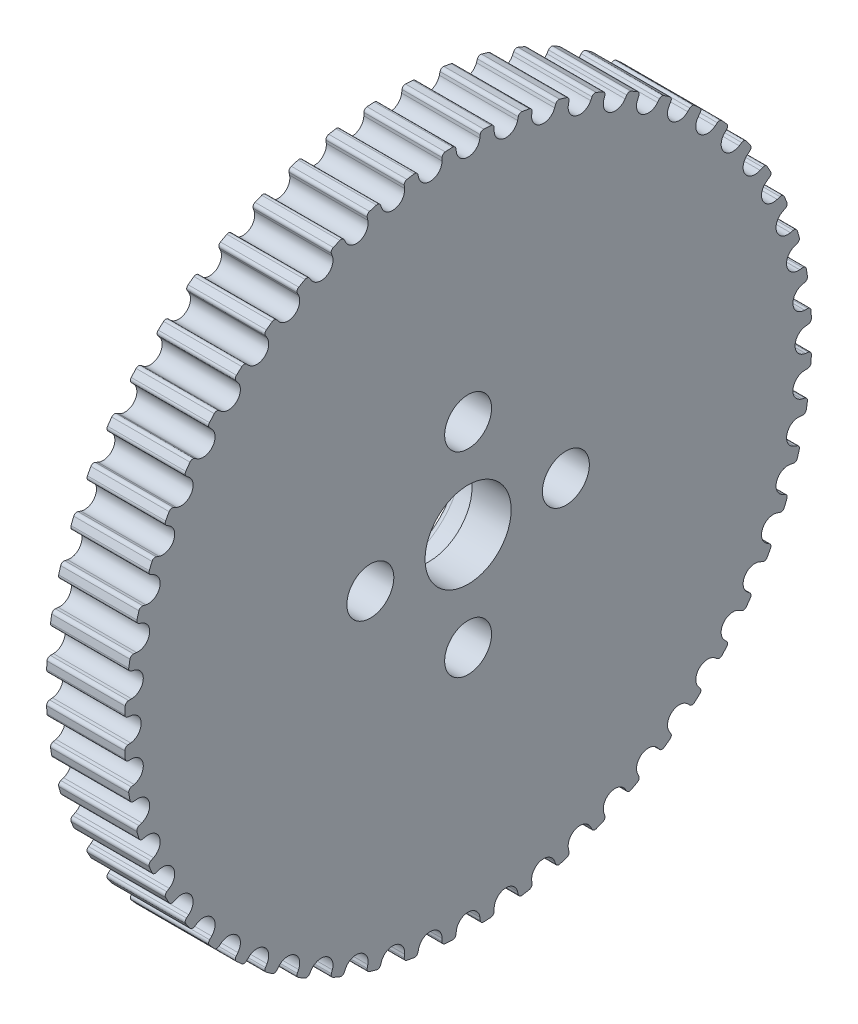
from build123d import *

# Parameters (mm, degrees)
CUT_EXTRUDE_2_REACH      = 39.757
PATTERN_CIRCULAR_3_COUNT = 56
SKETCH_7_R               = 3.3
CUT_EXTRUDE_3_DEPTH      = 10
FILLET_1_OUTLINE_R       = 3.3
FILLET_1_DEPTH           = 3
FILLET_START             = 3
FILLET_1_2_OUTLINE_R     = 1.8
FILLET_1_2_DEPTH         = 4


with BuildPart() as part:
    # 草图1 → 旋转1 (revolve)
    with BuildSketch(Plane.XY, mode=Mode.PRIVATE) as revolve_1_sk:
        Polygon((0, 5.2718), (0, 26.359), (6, 26.359), (6, 10.5436), (6, 0), (0, 0), align=None)
    revolve(revolve_1_sk.sketch.rotate(Axis((0, 0, 0), (1, 0, 0)), 90), axis=Axis((0, 0, 0), (1, 0, 0)))

    # 草图6 → 切除-拉伸2 (cut, up to next)
    with BuildSketch(Plane(origin=(0, 0, 0), x_dir=(0, 0, -1), z_dir=(1, 0, 0)), mode=Mode.PRIVATE) as cut_extrude_2_sk1:
        with BuildLine():
            Line((0.930903788, 26.103589707), (0.903216998, 25.878098898))
            ThreePointArc((0.903216998, 25.878098898), (0, 25.079), (-0.903216998, 25.878098898))
            Line((-0.903216998, 25.878098898), (-0.930903788, 26.103589707))
            ThreePointArc((-0.930903788, 26.103589707), (-1.021165973, 26.270506855), (-1.200810345, 26.331633742))
            ThreePointArc((-1.200810345, 26.331633742), (-1.330660773, 26.32539122), (-1.460478834, 26.318508365))
            Line((-1.460478834, 26.318508365), (-1.657126823, 27.920077708))
            ThreePointArc((-1.657126823, 27.920077708), (0, 27.969211796), (1.657126823, 27.920077708))
            Line((1.657126823, 27.920077708), (1.460478834, 26.318508365))
            ThreePointArc((1.460478834, 26.318508365), (1.330660773, 26.32539122), (1.200810345, 26.331633742))
            ThreePointArc((1.200810345, 26.331633742), (1.021165973, 26.270506855), (0.930903788, 26.103589707))
        make_face()
    cut_extrude_2_tool1 = extrude(cut_extrude_2_sk1.sketch, amount=CUT_EXTRUDE_2_REACH, mode=Mode.PRIVATE) & part.part
    cut_extrude_2 = cut_extrude_2_tool1.solids().sort_by_distance((0, 26.777178, 0))[0]
    add(cut_extrude_2, mode=Mode.SUBTRACT)

    # 阵列(圆周)3: 切除-拉伸2 ×56 about axis
    pattern_circular_3_axis = Axis((0, 0, 0), (1, 0, 0))
    for i in range(1, PATTERN_CIRCULAR_3_COUNT):
        add(cut_extrude_2.rotate(pattern_circular_3_axis, i * 360 / PATTERN_CIRCULAR_3_COUNT), mode=Mode.SUBTRACT)

    # 草图7 → 切除-拉伸3 (cut)
    with BuildSketch(Plane(origin=(6, 0, 0), x_dir=(0, 0, -1), z_dir=(1, 0, 0))):
        Circle(SKETCH_7_R)
    extrude(amount=-CUT_EXTRUDE_3_DEPTH, mode=Mode.SUBTRACT)

    # 圆角1: read off the stored shape, not the designer's step
    # 圆角1 outline → 圆角1 (cut)
    with BuildSketch(Plane.YZ):
        with BuildLine():
            ThreePointArc((1.105551333, -4.9275), (3.570889245, -3.570889245), (4.9275, -1.105551333))
            ThreePointArc((4.9275, -1.105551333), (10.3, -6.43e-07), (4.927492609, 1.105534136))
            ThreePointArc((4.927492609, 1.105534136), (3.570889245, 3.570889245), (1.105551333, 4.9275))
            ThreePointArc((1.105551333, 4.9275), (6.43e-07, 10.3), (-1.105534136, 4.927492609))
            ThreePointArc((-1.105534136, 4.927492609), (-3.570889245, 3.570889245), (-4.9275, 1.105551333))
            ThreePointArc((-4.9275, 1.105551333), (-10.3, 6.43e-07), (-4.927492609, -1.105534136))
            ThreePointArc((-4.927492609, -1.105534136), (-3.570889245, -3.570889245), (-1.105551333, -4.9275))
            ThreePointArc((-1.105551333, -4.9275), (-6.43e-07, -10.3), (1.105551333, -4.9275))
        make_face()
        Circle(FILLET_1_OUTLINE_R, mode=Mode.SUBTRACT)
    extrude(amount=FILLET_1_DEPTH, mode=Mode.SUBTRACT)

    # Fillet 1 2 outline → Fillet 1 2 (cut)
    with BuildSketch(Plane.YZ.offset(FILLET_START)):
        with Locations((0, -7.5)):
            Circle(FILLET_1_2_OUTLINE_R)
        with Locations((-7.5, 0)):
            Circle(FILLET_1_2_OUTLINE_R)
        with Locations((0, 7.5)):
            Circle(FILLET_1_2_OUTLINE_R)
        with Locations((7.5, 0)):
            Circle(FILLET_1_2_OUTLINE_R)
    extrude(amount=FILLET_1_2_DEPTH, mode=Mode.SUBTRACT)

    # Fillet 1 3 outline → Fillet 1 3 (revolve, cut)
    with BuildSketch(Plane.YX):
        with BuildLine():
            ThreePointArc((5.55, 0), (5.196446609, 0.146446609), (5.05, 0.5))
            Line((5.05, 0.5), (0, 0.5))
            Line((0, 0.5), (0, 0))
            Line((0, 0), (5.55, 0))
        make_face()
    revolve(axis=Axis((0, 0, 0), (1, 0, 0)), mode=Mode.SUBTRACT)


solid = part.part
